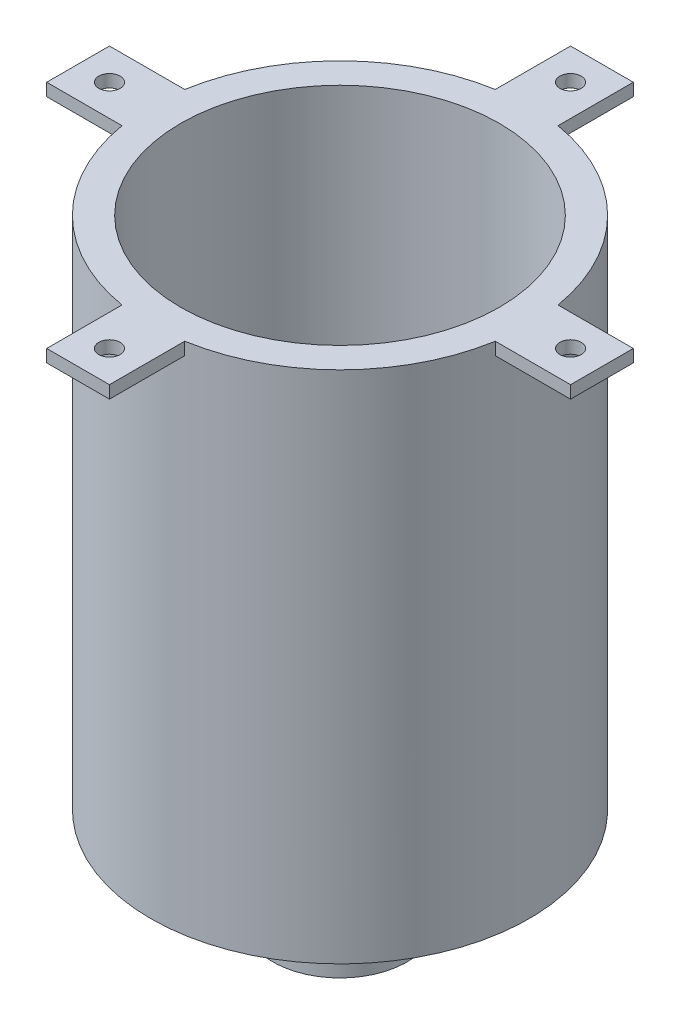
from build123d import *

# Parameters (mm, degrees)
SKETCH5_OUTSIDE_W   = 34.468
SKETCH5_OUTSIDE_H   = 34.468
CUT_EXTRUDE1_DEPTH  = 7.2
BOSS_EXTRUDE1_REACH = 51.718
SKETCH10_R          = 10.705
SKETCH10_R_2        = 6.9
BOSS_EXTRUDE3_REACH = 31.655
SKETCH12_R          = 8.3
CUT_EXTRUDE3_REACH  = 53.775
SKETCH13_R          = 3.45
SKETCH14_R          = 23.979548074
CUT_EXTRUDE5_DEPTH  = 32
BOSS_EXTRUDE4_START = 2
SKETCH16_R          = 30.1625
SKETCH16_R_2        = 7.874
BOSS_EXTRUDE4_DEPTH = 2
BOSS_EXTRUDE5_START = 80
SKETCH17_R          = 30.1625
SKETCH17_R_2        = 25.4
BOSS_EXTRUDE5_DEPTH = 80
SKETCH18_R          = 1.7
BOSS_EXTRUDE6_DEPTH = 2


# Read off the part's stored shape, not the designer's step: Cut-Extrude2
with BuildPart() as part:
    # Sketch1 → Revolve1 (revolve)
    with BuildSketch(Plane.XY, mode=Mode.PRIVATE) as revolve1_sk:
        Polygon((3.25, 47.7), (4.8, 47.7), (5.2, 43.217813034), (4.8, 42.533333333), (5.2, 38.051146367), (4.8, 37.366666667), (5.2, 32.8844797), (4.8, 32.2), (5.25, 26.2), (5.25, 22.2), (10.6, 22.2), (10.6, 15), (8.3, 15), (8.3, 0), (5.5, 0), (5.5, 18), (3.25, 19.7), align=None)
    revolve(revolve1_sk.sketch.rotate(Axis((0, 0, 0), (0, 1, 0)), 90), axis=Axis((0, 0, 0), (0, 1, 0)))

    # Sketch5 outside → Cut-Extrude1 (cut)
    with BuildSketch(Plane(origin=(0, 22.2, 0), x_dir=(1, 0, 0), z_dir=(0, 1, 0))):
        Rectangle(SKETCH5_OUTSIDE_W, SKETCH5_OUTSIDE_H)
        Polygon((-5.3, 9.17986928), (5.3, 9.17986928), (10.6, 0), (5.3, -9.17986928), (-5.3, -9.17986928), (-10.6, 0), align=None, mode=Mode.SUBTRACT)
    extrude(amount=-CUT_EXTRUDE1_DEPTH, mode=Mode.SUBTRACT)

    # Sketch4 → Cut-Revolve1 (revolve, cut)
    with BuildSketch(Plane.XY, mode=Mode.PRIVATE) as cut_revolve1_sk:
        Polygon((6.9, 0), (8.3, 1.4), (8.3, 0), align=None)
        Polygon((8.3, 15), (10.6, 15.837131539), (10.6, 15), align=None)
        Polygon((8.3, 22.2), (10.6, 21.362868461), (10.6, 22.2), align=None)
    revolve(cut_revolve1_sk.sketch.rotate(Axis((0, 0, 0), (0, 1, 0)), 90), axis=Axis((0, 0, 0), (0, 1, 0)), mode=Mode.SUBTRACT)

    # Boss-Extrude1: up to this cone (the profile starts outside it)
    boss_extrude1_end = Plane(origin=(0, 0, 0), z_dir=(0, 1, 0)).offset(11.979048056) * Cone(2.747e-06, 110.555614597, 40.238951944, align=(Align.CENTER, Align.CENTER, Align.MIN), mode=Mode.PRIVATE)
    # Sketch10 → Boss-Extrude1 (add, up to the surface)
    with BuildSketch(Plane.XZ, mode=Mode.PRIVATE) as boss_extrude1_sk1:
        with Locations(Location((0, 0, 0), (0, 0, 270))):
            Circle(SKETCH10_R)
        Circle(SKETCH10_R_2, mode=Mode.SUBTRACT)
    boss_extrude1_tool1 = extrude(boss_extrude1_sk1.sketch, amount=-BOSS_EXTRUDE1_REACH, mode=Mode.PRIVATE) - boss_extrude1_end
    add(boss_extrude1_tool1.solids().sort_by_distance((0, 0, 10.402217))[0])

    # Cut-Extrude2 outline → Cut-Extrude2 (revolve, cut)
    with BuildSketch(Plane.XY):
        Polygon((7.874, 16.206311111), (5.5, 18), (5.5, 0), (7.874, 0), align=None)
    revolve(axis=Axis((0, 0, 0), (0, 1, 0)), mode=Mode.SUBTRACT)

    # Boss-Extrude3: up to this cone (the profile starts inside it)
    boss_extrude3_end = Plane(origin=(0, 22.2, 0), z_dir=(0, 1, 0)).offset(-10.220951944) * Cone(2.747e-06, 193.581188051, 70.457789364, align=(Align.CENTER, Align.CENTER, Align.MIN), mode=Mode.PRIVATE)
    # Sketch12 → Boss-Extrude3 (add, up to the surface)
    with BuildSketch(Plane(origin=(0, 22.2, 0), x_dir=(1, 0, 0), z_dir=(0, 1, 0)), mode=Mode.PRIVATE) as boss_extrude3_sk1:
        Polygon((-7.609401077, 13.17986928), (-15.218802154, 0), (-7.609401077, -13.17986928), (7.609401077, -13.17986928), (15.218802154, 0), (7.609401077, 13.17986928), align=None)
        Circle(SKETCH12_R, mode=Mode.SUBTRACT)
    boss_extrude3_tool1 = extrude(boss_extrude3_sk1.sketch, amount=-BOSS_EXTRUDE3_REACH, mode=Mode.PRIVATE) & boss_extrude3_end
    add(boss_extrude3_tool1.solids().sort_by_distance((-11.065395, 22.2, -6.388609))[0])

    # Cut-Extrude3: up to this cone (the profile starts outside it)
    cut_extrude3_end = Plane(origin=(0, 47.7, 0), z_dir=(0, -1, 0)).offset(25.544445444) * Cone(1.324e-06, 38.025735294, 28.730554556, align=(Align.CENTER, Align.CENTER, Align.MIN), mode=Mode.PRIVATE)
    # Sketch13 → Cut-Extrude3 (cut, up to the surface)
    with BuildSketch(Plane(origin=(0, 47.7, 0), x_dir=(1, 0, 0), z_dir=(0, 1, 0)), mode=Mode.PRIVATE) as cut_extrude3_sk1:
        with Locations(Location((0, 0, 0), (0, 0, 270))):
            Circle(SKETCH13_R)
    cut_extrude3_tool1 = extrude(cut_extrude3_sk1.sketch, amount=-CUT_EXTRUDE3_REACH, mode=Mode.PRIVATE) - cut_extrude3_end
    add(cut_extrude3_tool1.solids().sort_by_distance((0, 47.7, 0))[0], mode=Mode.SUBTRACT)

    # Sketch14 → Cut-Extrude5 (cut)
    with BuildSketch(Plane(origin=(0, 47.7, 0), x_dir=(1, 0, 0), z_dir=(0, 1, 0))):
        Circle(SKETCH14_R)
    extrude(amount=-CUT_EXTRUDE5_DEPTH, mode=Mode.SUBTRACT)

    # Sketch16 → Boss-Extrude4 (add)
    with BuildSketch(Plane(origin=(0, 15.7, 0), x_dir=(1, 0, 0), z_dir=(0, 1, 0)).offset(BOSS_EXTRUDE4_START)):
        with Locations(Location((0, 0, 0), (0, 0, 270))):
            Circle(SKETCH16_R)
        with Locations(Location((0, 0, 0), (0, 0, 90))):
            Circle(SKETCH16_R_2, mode=Mode.SUBTRACT)
    extrude(amount=-BOSS_EXTRUDE4_DEPTH)

    # Sketch17 → Boss-Extrude5 (add)
    with BuildSketch(Plane(origin=(0, 17.7, 0), x_dir=(1, 0, 0), z_dir=(0, 1, 0)).offset(BOSS_EXTRUDE5_START)):
        with Locations(Location((0, 0, 0), (0, 0, 270))):
            Circle(SKETCH17_R)
        with Locations(Location((0, 0, 0), (0, 0, 270))):
            Circle(SKETCH17_R_2, mode=Mode.SUBTRACT)
    extrude(amount=-BOSS_EXTRUDE5_DEPTH)

    # Sketch18 → Boss-Extrude6 (add)
    # profile 1 of 8: a face of its own
    with BuildSketch(Plane(origin=(0, 97.7, 0), x_dir=(1, 0, 0), z_dir=(0, 1, 0))):
        with BuildLine():
            ThreePointArc((-29.745191313, -5), (-30.1625, 0), (-29.745191313, 5))
            Line((-29.745191313, 5), (-41.745191313, 5))
            Line((-41.745191313, 5), (-41.745191313, -5))
            Line((-41.745191313, -5), (-29.745191313, -5))
        make_face()
        with Locations(Location((-36.745191313, 0, 0), (0, 0, 270))):
            Circle(SKETCH18_R, mode=Mode.SUBTRACT)
    # profile 2 of 8: a face of its own
    with BuildSketch(Plane(origin=(0, 97.7, 0), x_dir=(1, 0, 0), z_dir=(0, 1, 0))):
        with BuildLine():
            Line((-29.745191313, -5), (-29.745191313, 5))
            ThreePointArc((-29.745191313, 5), (-30.1625, 0), (-29.745191313, -5))
        make_face()
    # profile 3 of 8: a face of its own
    with BuildSketch(Plane(origin=(0, 97.7, 0), x_dir=(1, 0, 0), z_dir=(0, 1, 0))):
        with BuildLine():
            ThreePointArc((29.745191313, -5), (30.1625, 0), (29.745191313, 5))
            Line((29.745191313, 5), (29.745191313, -5))
        make_face()
    # profile 4 of 8: a face of its own
    with BuildSketch(Plane(origin=(0, 97.7, 0), x_dir=(1, 0, 0), z_dir=(0, 1, 0))):
        with BuildLine():
            Line((41.745191313, 5), (29.745191313, 5))
            ThreePointArc((29.745191313, 5), (30.1625, 0), (29.745191313, -5))
            Line((29.745191313, -5), (41.745191313, -5))
            Line((41.745191313, -5), (41.745191313, 5))
        make_face()
        with Locations(Location((36.745191313, 0, 0), (0, 0, 270))):
            Circle(SKETCH18_R, mode=Mode.SUBTRACT)
    # profile 5 of 8: a face of its own
    with BuildSketch(Plane(origin=(0, 97.7, 0), x_dir=(1, 0, 0), z_dir=(0, 1, 0))):
        with BuildLine():
            ThreePointArc((5, -29.745191313), (0, -30.1625), (-5, -29.745191313))
            Line((-5, -29.745191313), (-5, -41.745191313))
            Line((-5, -41.745191313), (5, -41.745191313))
            Line((5, -41.745191313), (5, -29.745191313))
        make_face()
        with Locations(Location((0, -36.745191313, 0), (0, 0, 270))):
            Circle(SKETCH18_R, mode=Mode.SUBTRACT)
    # profile 6 of 8: a face of its own
    with BuildSketch(Plane(origin=(0, 97.7, 0), x_dir=(1, 0, 0), z_dir=(0, 1, 0))):
        with BuildLine():
            Line((5, -29.745191313), (-5, -29.745191313))
            ThreePointArc((-5, -29.745191313), (0, -30.1625), (5, -29.745191313))
        make_face()
    # profile 7 of 8: a face of its own
    with BuildSketch(Plane(origin=(0, 97.7, 0), x_dir=(1, 0, 0), z_dir=(0, 1, 0))):
        with BuildLine():
            ThreePointArc((5, 29.745191313), (0, 30.1625), (-5, 29.745191313))
            Line((-5, 29.745191313), (5, 29.745191313))
        make_face()
    # profile 8 of 8: a face of its own
    with BuildSketch(Plane(origin=(0, 97.7, 0), x_dir=(1, 0, 0), z_dir=(0, 1, 0))):
        with BuildLine():
            Line((-5, 41.745191313), (-5, 29.745191313))
            ThreePointArc((-5, 29.745191313), (0, 30.1625), (5, 29.745191313))
            Line((5, 29.745191313), (5, 41.745191313))
            Line((5, 41.745191313), (-5, 41.745191313))
        make_face()
        with Locations(Location((0, 36.745191313, 0), (0, 0, 270))):
            Circle(SKETCH18_R, mode=Mode.SUBTRACT)
    extrude(amount=-BOSS_EXTRUDE6_DEPTH)


solid = part.part
